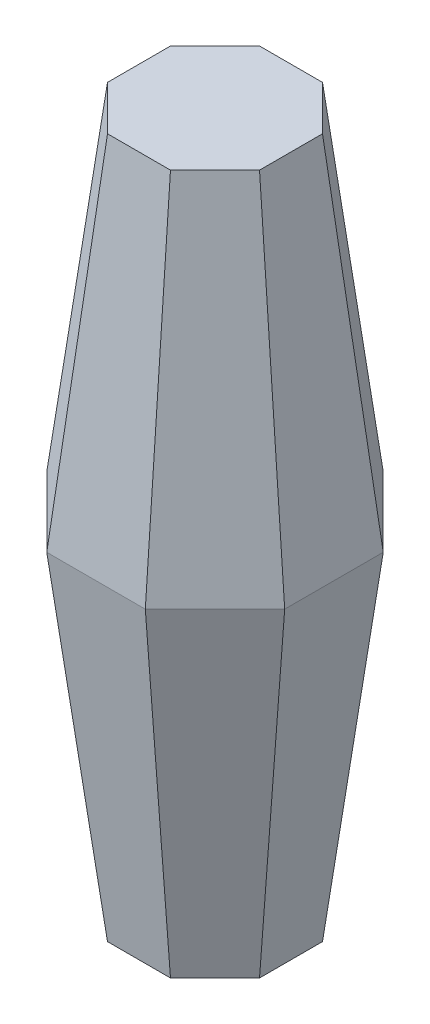
from build123d import *

# Parameters (mm, degrees)
BOSS_EXTRUDE1_DEPTH = 50
BOSS_EXTRUDE1_DRAFT = -7
MIRROR1_DEPTH       = 50
MIRROR1_DRAFT       = 7


# Read off the part's stored shape, not the designer's step: Mirror1
with BuildPart() as part:
    # Sketch2 → Boss-Extrude1 (with draft: the straight prism first)
    with BuildSketch(Plane(origin=(0, 0, 0), x_dir=(1, 0, 0), z_dir=(0, 1, 0))):
        Polygon((-10.863961031, 4.5), (-10.863961031, -4.5), (-4.5, -10.863961031), (4.5, -10.863961031), (10.863961031, -4.5), (10.863961031, 4.5), (4.5, 10.863961031), (-4.5, 10.863961031), align=None)
    extrude(amount=BOSS_EXTRUDE1_DEPTH)
    # Boss-Extrude1: the draft: its side faces are tilted about the plane it starts from
    boss_extrude1_sides = [part.faces().sort_by_distance(p)[0] for p in [
        (-10.863961031, 25, 0),
        (-7.681980515, 25, 7.681980515),
        (0, 25, 10.863961031),
        (7.681980515, 25, 7.681980515),
        (10.863961031, 25, 0),
        (7.681980515, 25, -7.681980515),
        (0, 25, -10.863961031),
        (-7.681980515, 25, -7.681980515),
    ]]
    draft(boss_extrude1_sides, Plane(origin=(0, 0, 0), x_dir=(1, 0, 0), z_dir=(0, 1, 0)), BOSS_EXTRUDE1_DRAFT)


with BuildPart() as mirror1_tool:
    # Mirror1 outline → Mirror1 (with draft: the straight prism first)
    with BuildSketch(Plane(origin=(0, 100, 0), x_dir=(1, 0, 0), z_dir=(0, 1, 0))):
        Polygon((-10.863961031, -4.5), (-4.5, -10.863961031), (4.5, -10.863961031), (10.863961031, -4.5), (10.863961031, 4.5), (4.5, 10.863961031), (-4.5, 10.863961031), (-10.863961031, 4.5), align=None)
    extrude(amount=-MIRROR1_DEPTH)
    # Mirror1: the draft: its side faces are tilted about the plane it starts from
    mirror1_sides = [mirror1_tool.faces().sort_by_distance(p)[0] for p in [
        (-7.681980515, 75, 7.681980516),
        (0, 75, 10.863961031),
        (7.681980516, 75, 7.681980515),
        (10.863961031, 75, 0),
        (7.681980515, 75, -7.681980516),
        (0, 75, -10.863961031),
        (-7.681980516, 75, -7.681980515),
        (-10.863961031, 75, 0),
    ]]
    draft(mirror1_sides, Plane(origin=(0, 100, 0), x_dir=(1, 0, 0), z_dir=(0, 1, 0)), MIRROR1_DRAFT)


with BuildPart() as part_1:
    add(part.part)

    # Mirror1: add mirror1_tool
    add(mirror1_tool.part)


solid = part_1.part
